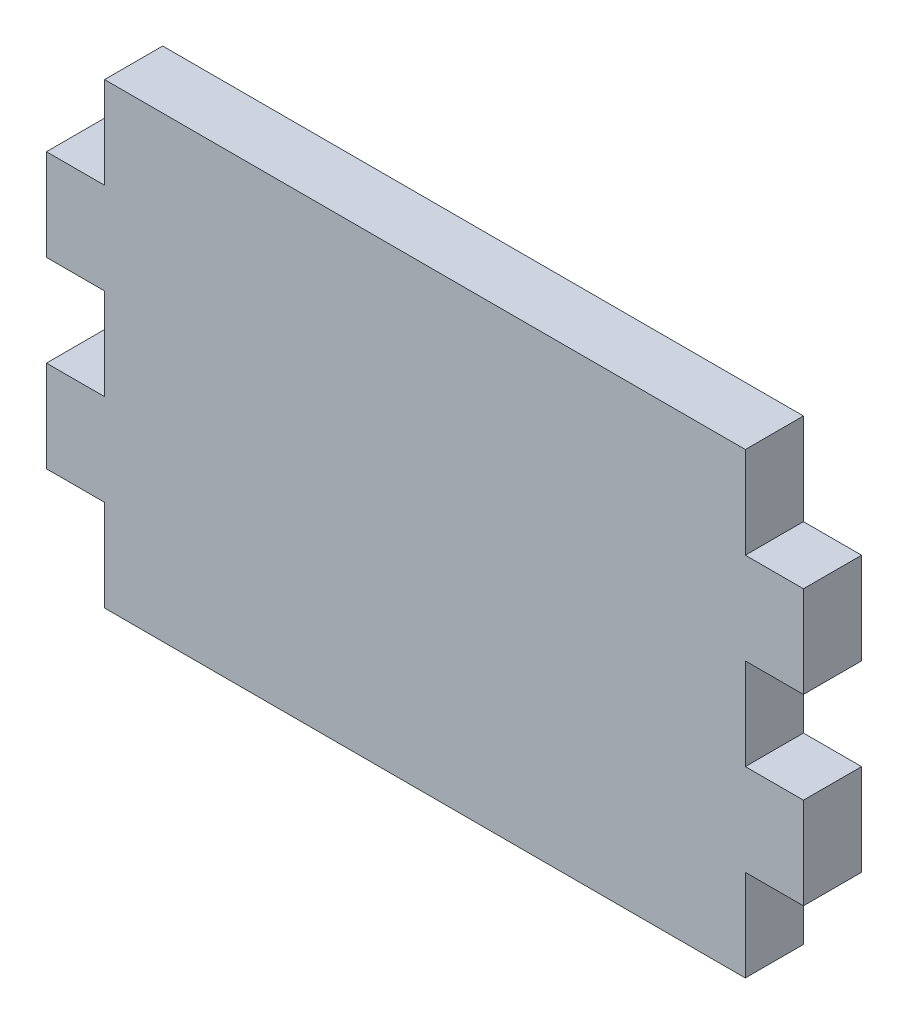
from build123d import *

# Parameters (mm, degrees)
BODY_DEPTH = 6.35


with BuildPart() as part:
    # Sketch1 → Body (new body)
    with BuildSketch(Plane.XY):
        Polygon((-70, 50), (-70, 40), (-76.35, 40), (-76.35, 30), (-70, 30), (-70, 20), (-76.35, 20), (-76.35, 10), (-70, 10), (-70, 0), (0, 0), (0, 10), (6.35, 10), (6.35, 20), (0, 20), (0, 30), (6.35, 30), (6.35, 40), (0, 40), (0, 50), align=None)
    extrude(amount=BODY_DEPTH)


solid = part.part
